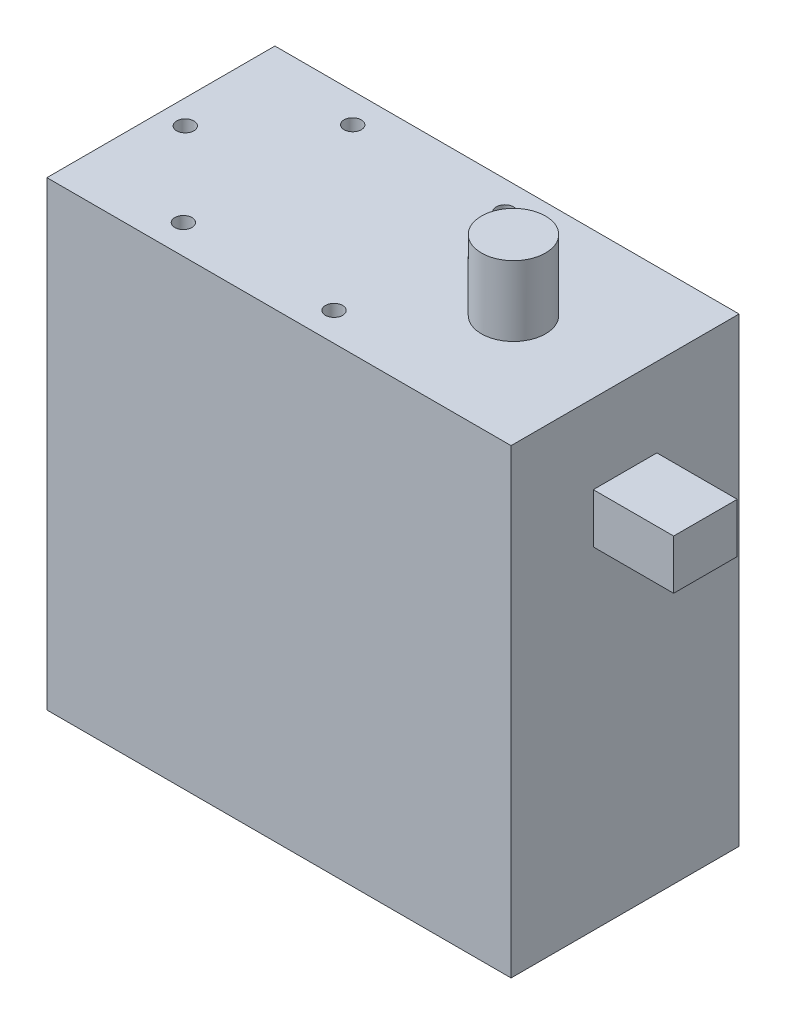
from build123d import *

# Parameters (mm, degrees)
SKETCH1_W              = 40.43
SKETCH1_H              = 40.16
SERVOBODY_DEPTH        = 19.86
SKETCH2_R              = 2.79
GEARHINGE_DEPTH        = 6.1
SKETCH3_R              = 3.01
SMOOTHHINGE_DEPTH      = 5.5
SKETCH4_R              = 0.75
GEARSCREWHOLES_DEPTH   = 2
SKETCH5_R              = 0.75
SMOOTHSCREWHOLES_DEPTH = 2
SKETCH6_W              = 5.54
SKETCH6_H              = 4.32
CABLE_DEPTH            = 7


with BuildPart() as part:
    # Sketch1 → ServoBody (new body)
    with BuildSketch(Plane.XY):
        with Locations((20.215, 20.08)):
            Rectangle(SKETCH1_W, SKETCH1_H)
    extrude(amount=SERVOBODY_DEPTH)

    # Sketch2 → GearHinge (add)
    with BuildSketch(Plane(origin=(0, 40.16, 0), x_dir=(1, 0, 0), z_dir=(0, 1, 0))):
        with Locations((30.71, -9.93)):
            Circle(SKETCH2_R)
    extrude(amount=GEARHINGE_DEPTH)

    # Sketch3 → SmoothHinge (add)
    with BuildSketch(Plane.XZ):
        with Locations((30.71, 9.93)):
            Circle(SKETCH3_R)
    extrude(amount=SMOOTHHINGE_DEPTH)

    # Sketch4 → GearScrewHoles (cut)
    with BuildSketch(Plane(origin=(0, 40.16, 0), x_dir=(1, 0, 0), z_dir=(0, 1, 0))):
        with Locations((22.52, -2.49)):
            Circle(SKETCH4_R)
        with Locations((22.52, -17.37)):
            Circle(SKETCH4_R)
        with Locations((2.12, -9.93)):
            Circle(SKETCH4_R)
        with Locations((9.33, -2.555)):
            Circle(SKETCH4_R)
        with Locations((9.33, -17.305)):
            Circle(SKETCH4_R)
    extrude(amount=-GEARSCREWHOLES_DEPTH, mode=Mode.SUBTRACT)

    # Sketch5 → SmoothScrewHoles (cut)
    with BuildSketch(Plane.XZ):
        with Locations((17.5, 17.92)):
            Circle(SKETCH5_R)
        with Locations((38.62, 17.92)):
            Circle(SKETCH5_R)
        with Locations((2.3, 17.92)):
            Circle(SKETCH5_R)
        with Locations((17.5, 1.94)):
            Circle(SKETCH5_R)
        with Locations((38.62, 1.94)):
            Circle(SKETCH5_R)
        with Locations((2.3, 1.94)):
            Circle(SKETCH5_R)
    extrude(amount=-SMOOTHSCREWHOLES_DEPTH, mode=Mode.SUBTRACT)

    # Sketch6 → Cable (add)
    with BuildSketch(Plane(origin=(40.43, 0, 0), x_dir=(0, 0, -1), z_dir=(1, 0, 0))):
        with Locations((-9.93, 31.1)):
            Rectangle(SKETCH6_W, SKETCH6_H)
    extrude(amount=CABLE_DEPTH)


solid = part.part
